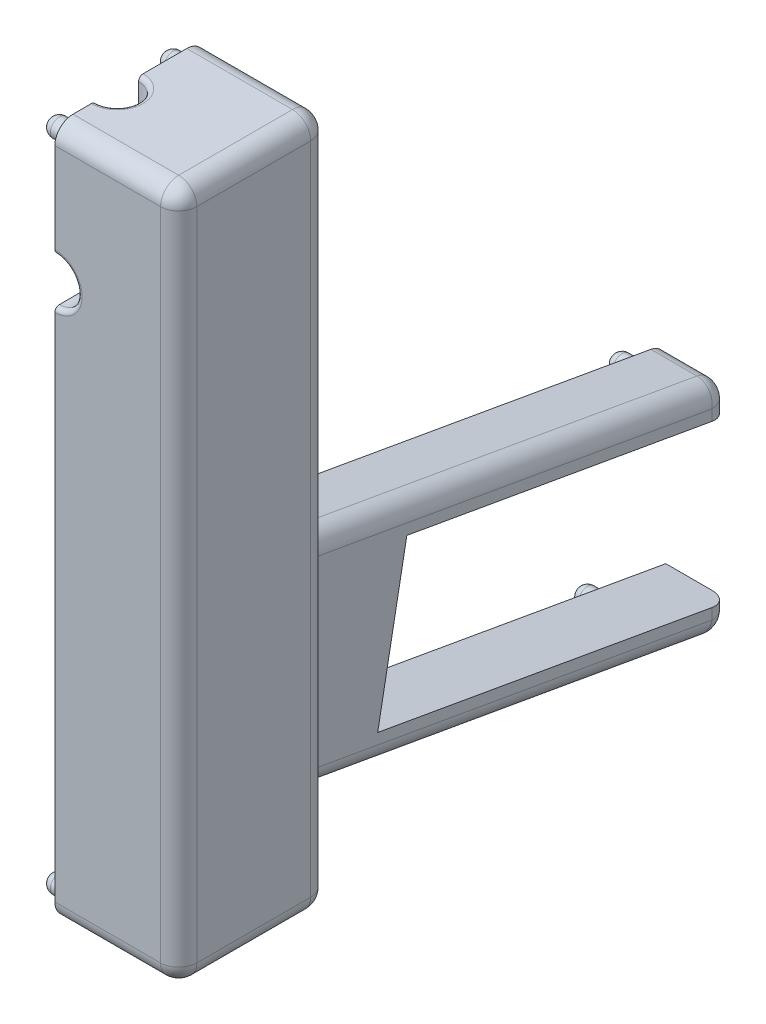
from build123d import *

# Parameters (mm, degrees)
SKETCH1_W                = 27.305
SKETCH1_H                = 33.1
BOSS_EXTRUDE1_DEPTH      = 152.4
SKETCH2_W                = 20.4
SKETCH2_H                = 139.7
CUT_EXTRUDE1_DEPTH       = 19.05
HITLED_REACH             = 160.325
SKETCH6_W                = 6.35
SKETCH6_H                = 74.93
PCB_DEPTH                = 6.35
SKETCH16_R               = 2
PRESSFIT_DEPTH           = 5
FILLET_PRESSFIT_R        = 2
BUTT_DEPTH               = 14.175
BATTERYPACK_DEPTH        = 14.175
SKETCH22_R               = 2
PRESSFIT_BOTTOM_DEPTH    = 5
IRLED_REACH              = 206.379
FILLET_BODY_R            = 4
FILLET_PRESSFIT_BOTTOM_R = 2
FILLET_LED_S_R           = 1


with BuildPart() as part:
    # Sketch1 → Boss-Extrude1 (new body)
    with BuildSketch(Plane(origin=(0, 0, 0), x_dir=(1, 0, 0), z_dir=(0, 1, 0))):
        with Locations((13.6525, 16.55)):
            Rectangle(SKETCH1_W, SKETCH1_H)
    extrude(amount=BOSS_EXTRUDE1_DEPTH)

    # Sketch2 → Cut-Extrude1 (cut)
    with BuildSketch(Plane.ZY):
        with Locations((-16.55, 76.2)):
            Rectangle(SKETCH2_W, SKETCH2_H)
    extrude(amount=-CUT_EXTRUDE1_DEPTH, mode=Mode.SUBTRACT)

    # Sketch3 → HitLED (cut, up to next)
    with BuildSketch(Plane.XY, mode=Mode.PRIVATE) as hitled_sk1:
        with BuildLine():
            Line((0, 127.555), (0, 117.555))
            ThreePointArc((0, 117.555), (5, 122.555), (0, 127.555))
        make_face()
    hitled_tool1 = extrude(hitled_sk1.sketch, amount=-HITLED_REACH, mode=Mode.PRIVATE) & part.part
    add(hitled_tool1.solids().sort_by_distance((2.122066, 122.555, 0))[0], mode=Mode.SUBTRACT)

    # Sketch6 → PCB (add)
    with BuildSketch(Plane.ZY.offset(-19.05)):
        with Locations((-12.525, 70.485)):
            Rectangle(SKETCH6_W, SKETCH6_H)
        with Locations((-20.575, 70.485)):
            Rectangle(SKETCH6_W, SKETCH6_H)
    extrude(amount=PCB_DEPTH)

    # Sketch16 → PressFit (add)
    with BuildSketch(Plane.ZY):
        with Locations((-4, 148.4)):
            Circle(SKETCH16_R)
        with Locations((-4, 4)):
            Circle(SKETCH16_R)
        with Locations((-29.1, 148.4)):
            Circle(SKETCH16_R)
        with Locations((-29.1, 4)):
            Circle(SKETCH16_R)
    extrude(amount=PRESSFIT_DEPTH)

    # Fillet-PressFit
    fillet_pressfit_edges = [part.edges().sort_by_distance(p)[0] for p in [
        (-5, 4, -31.1),
        (-5, 4, -6),
        (-5, 148.4, -31.1),
        (-5, 148.4, -6),
    ]]
    fillet(fillet_pressfit_edges, radius=FILLET_PRESSFIT_R)

    # Sketch23 → Butt (add)
    with BuildSketch(Plane(origin=(0, 0, -25.4), x_dir=(0, 0, 1), z_dir=(-1, 0, 0))):
        Polygon((-7.7, 61.135849387), (-7.7, 12.7), (-109.3, -5.21482124), (-109.3, 43.221028147), align=None)
    extrude(amount=-BUTT_DEPTH)

    # Sketch20 → BatteryPack (cut)
    with BuildSketch(Plane.ZY):
        Polygon((-63.435596448, 49.338906272), (-57.003300004, 14.933162267), (-123.973771116, 3.124461299), (-134.7, 1.233137745), (-134.7, 36.773069161), (-130.40606756, 37.530205304), align=None)
    extrude(amount=-BATTERYPACK_DEPTH, mode=Mode.SUBTRACT)

    # Sketch22 → PressFit - Bottom (add)
    with BuildSketch(Plane.ZY):
        with Locations((-128.066987256, 41.166627764)):
            Circle(SKETCH22_R)
        with Locations((-120.442926047, 0.523065057)):
            Circle(SKETCH22_R)
    extrude(amount=PRESSFIT_BOTTOM_DEPTH)

    # Sketch25 → IRLED (cut, up to next)
    with BuildSketch(Plane.XZ.offset(-146.05), mode=Mode.PRIVATE) as irled_sk1:
        with BuildLine():
            Line((0, -9.05), (0, -18.45))
            ThreePointArc((0, -18.45), (4.7, -13.75), (0, -9.05))
        make_face()
    irled_tool1 = extrude(irled_sk1.sketch, amount=-IRLED_REACH, mode=Mode.PRIVATE) & part.part
    add(irled_tool1.solids().sort_by_distance((1.994742, 146.05, -13.75))[0], mode=Mode.SUBTRACT)

    # Fillet - Body
    fillet_body_edges = [part.edges().sort_by_distance(p)[0] for p in [
        (14.175, -1.990841747, -134.7),
        (14.175, 39.997048654, -134.7),
        (7.0875, 43.221028147, -134.7),
        (7.0875, -5.21482124, -134.7),
        (14.175, 52.178438767, -83.9),
        (14.175, 3.74258938, -83.9),
        (7.0875, 12.7, -33.1),
        (14.175, 36.917924693, -33.1),
        (7.0875, 61.135849387, -33.1),
        (13.6525, 152.4, -33.1),
        (13.6525, 152.4, 0),
        (27.305, 152.4, -16.55),
        (27.305, 76.2, -33.1),
        (27.305, 0, -16.55),
        (13.6525, 0, -33.1),
        (13.6525, 0, 0),
        (27.305, 76.2, 0),
    ]]
    fillet(fillet_body_edges, radius=FILLET_BODY_R)

    # Fillet-PressFit-Bottom
    fillet_pressfit_bottom_edges = [part.edges().sort_by_distance(p)[0] for p in [
        (-5, 0.523065057, -122.442926047),
        (-5, 41.166627764, -130.066987256),
    ]]
    fillet(fillet_pressfit_bottom_edges, radius=FILLET_PRESSFIT_BOTTOM_R)

    # Fillet-LED's
    fillet_led_s_edges = [part.edges().sort_by_distance(p)[0] for p in [
        (4.7, 152.4, -13.75),
        (5, 122.555, 0),
    ]]
    fillet(fillet_led_s_edges, radius=FILLET_LED_S_R)


solid = part.part
